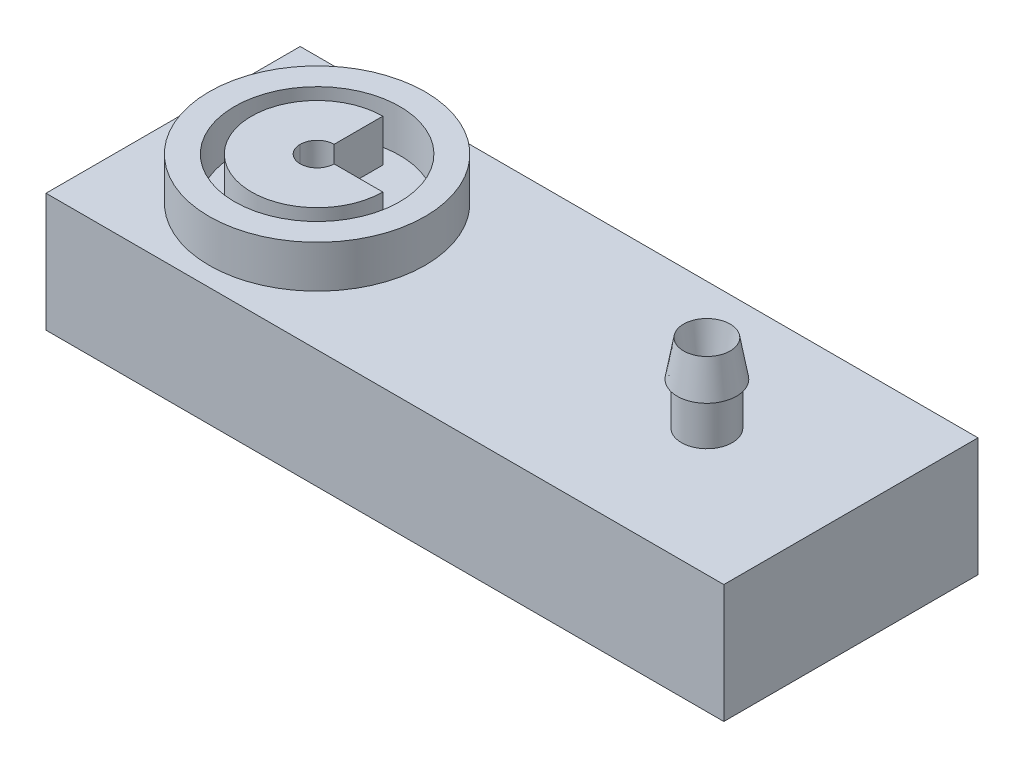
from build123d import *

# Parameters (mm, degrees)
SKETCH1_W                 = 80
SKETCH1_H                 = 30
BOSS_EXTRUDE1_DEPTH       = 5
SKETCH2_W                 = 80
SKETCH2_H                 = 30
SKETCH2_W_2               = 50
SKETCH2_H_2               = 4
BOSS_EXTRUDE2_DEPTH       = 4
SKETCH3_W                 = 80
SKETCH3_H                 = 30
SKETCH3_W_2               = 4
SKETCH3_H_2               = 4
BOSS_EXTRUDE4_DEPTH       = 5
VARFILLET2_R              = 2
BOSS_EXTRUDE5_OUTLINE_R   = 12.75
BOSS_EXTRUDE5_OUTLINE_R_2 = 9.75
BOSS_EXTRUDE5_DEPTH       = 5
SKETCH10_R                = 3
BOSS_EXTRUDE8_DEPTH       = 5
SKETCH12_R                = 3.5
SKETCH12_R_2              = 2
BOSS_EXTRUDE9_DEPTH       = 5
BOSS_EXTRUDE9_TAPER       = 10


# Read off the part's stored shape, not the designer's step: Boss-Extrude5
with BuildPart() as part:
    # Sketch1 → Boss-Extrude1 (new body)
    with BuildSketch(Plane(origin=(0, 0, 0), x_dir=(1, 0, 0), z_dir=(0, 1, 0))):
        with Locations((40, 15)):
            Rectangle(SKETCH1_W, SKETCH1_H)
    extrude(amount=BOSS_EXTRUDE1_DEPTH)

    # Sketch2 → Boss-Extrude2 (add)
    with BuildSketch(Plane(origin=(0, 5, 0), x_dir=(1, 0, 0), z_dir=(0, 1, 0))):
        with Locations((40, 15)):
            Rectangle(SKETCH2_W, SKETCH2_H)
        with Locations((40, 15)):
            Rectangle(SKETCH2_W_2, SKETCH2_H_2, mode=Mode.SUBTRACT)
    extrude(amount=BOSS_EXTRUDE2_DEPTH)

    # Sketch3 → Boss-Extrude4 (add)
    with BuildSketch(Plane(origin=(0, 9, 0), x_dir=(1, 0, 0), z_dir=(0, 1, 0))):
        with Locations((40, 15)):
            Rectangle(SKETCH3_W, SKETCH3_H)
        with Locations((17, 15)):
            Rectangle(SKETCH3_W_2, SKETCH3_H_2, mode=Mode.SUBTRACT)
        with Locations((63, 15)):
            Rectangle(SKETCH3_W_2, SKETCH3_H_2, mode=Mode.SUBTRACT)
    extrude(amount=BOSS_EXTRUDE4_DEPTH)

    # VarFillet2
    varfillet2_edges = [part.edges().sort_by_distance(p)[0] for p in [
        (19, 11.5, -13),
        (15, 9.5, -13),
        (15, 9.5, -17),
        (19, 11.5, -17),
        (40, 5, -13),
        (40, 9, -17),
        (40, 5, -17),
        (40, 9, -13),
        (61, 11.5, -17),
        (61, 11.5, -13),
        (65, 9.5, -17),
        (65, 9.5, -13),
    ]]
    fillet(varfillet2_edges, radius=VARFILLET2_R - 0.0001)  # a hair under: the kernel refuses the full size

    # Boss-Extrude5 outline → Boss-Extrude5 (add)
    # profile 1 of 2: a face of its own
    with BuildSketch(Plane(origin=(0, 14, 0), x_dir=(1, 0, 0), z_dir=(0, 1, 0))):
        with Locations((17, 15)):
            Circle(BOSS_EXTRUDE5_OUTLINE_R)
        with Locations((17, 15)):
            Circle(BOSS_EXTRUDE5_OUTLINE_R_2, mode=Mode.SUBTRACT)
    # profile 2 of 2: a face of its own
    with BuildSketch(Plane(origin=(0, 14, 0), x_dir=(1, 0, 0), z_dir=(0, 1, 0))):
        with BuildLine():
            Line((24.75, 15), (19, 15))
            add(Edge.make_bspline(
                [(19, 15), (19, 14.867945742), (18.987049656, 14.738096965), (18.936307764, 14.482629939), (18.897902055, 14.355690865), (18.797624318, 14.113595306), (18.736259729, 13.998768696), (18.591283808, 13.781444375), (18.506894302, 13.678533287), (18.230368557, 13.401809755), (18.007457904, 13.252768845), (17.526549216, 13.053070607), (17.264108516, 13), (17, 13)],
                knots=[0, 0, 0, 0, 0.125, 0.125, 0.25, 0.25, 0.375, 0.375, 0.5, 0.5, 0.75, 0.75, 1, 1, 1, 1], degree=3))
            add(Edge.make_bspline(
                [(17, 13), (16.867945742, 13), (16.738096965, 13.012950344), (16.482629939, 13.063692236), (16.355690865, 13.102097945), (16.113595306, 13.202375682), (15.998768696, 13.263740271), (15.781444375, 13.408716192), (15.678533287, 13.493105698), (15.401809755, 13.769631443), (15.252768845, 13.992542096), (15.053070607, 14.473450784), (15, 14.735891484), (15, 15)],
                knots=[0, 0, 0, 0, 0.125, 0.125, 0.25, 0.25, 0.375, 0.375, 0.5, 0.5, 0.75, 0.75, 1, 1, 1, 1], degree=3))
            add(Edge.make_bspline(
                [(15, 15), (15, 15.132054258), (15.012950344, 15.261903035), (15.063692236, 15.517370061), (15.102097945, 15.644309135), (15.202375682, 15.886404694), (15.263740271, 16.001231304), (15.408716192, 16.218555625), (15.493105698, 16.321466713), (15.769631443, 16.598190245), (15.992542096, 16.747231155), (16.473450784, 16.946929393), (16.735891484, 17), (17, 17)],
                knots=[0, 0, 0, 0, 0.125, 0.125, 0.25, 0.25, 0.375, 0.375, 0.5, 0.5, 0.75, 0.75, 1, 1, 1, 1], degree=3))
            Line((17, 17), (17, 22.75))
            ThreePointArc((17, 22.75), (11.519922446, 9.519922446), (24.75, 15))
        make_face()
    extrude(amount=BOSS_EXTRUDE5_DEPTH)

    # Sketch10 → Boss-Extrude8 (add)
    with BuildSketch(Plane(origin=(0, 14, 0), x_dir=(1, 0, 0), z_dir=(0, 1, 0))):
        with Locations(Location((63, 15, 0), (0, 0, 270))):
            Circle(SKETCH10_R)
        with BuildLine():
            ThreePointArc((63, 13), (61.585786438, 13.585786438), (61, 15))
            ThreePointArc((61, 15), (61.585786438, 16.414213562), (63, 17))
            ThreePointArc((63, 17), (64.414213562, 16.414213562), (65, 15))
            ThreePointArc((65, 15), (64.414213562, 13.585786438), (63, 13))
        make_face(mode=Mode.SUBTRACT)
    extrude(amount=BOSS_EXTRUDE8_DEPTH)

    # Sketch12 → Boss-Extrude9 (add)
    with BuildSketch(Plane(origin=(0, 19, 0), x_dir=(1, 0, 0), z_dir=(0, 1, 0))):
        with Locations((63, 15)):
            Circle(SKETCH12_R)
        with Locations((63, 15)):
            Circle(SKETCH12_R_2, mode=Mode.SUBTRACT)
    extrude(amount=BOSS_EXTRUDE9_DEPTH, taper=BOSS_EXTRUDE9_TAPER)


solid = part.part
